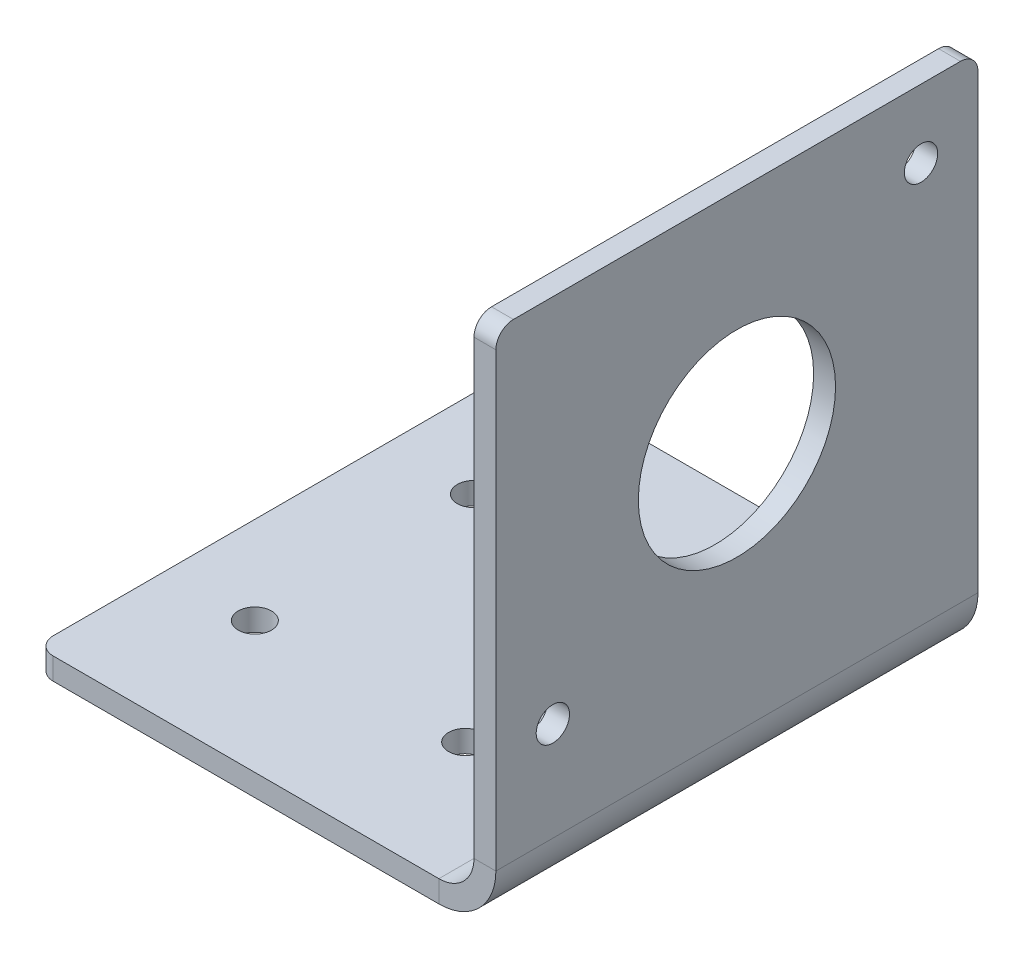
from build123d import *

# Parameters (mm, degrees)
SKETCH1_W              = 69.85
SKETCH1_H              = 76.2
SKETCH1_R              = 14.2875
SKETCH1_R_2            = 2.413
BOSS_EXTRUDE1_DEPTH    = 3.175
SKETCH2_W              = 69.85
SKETCH2_H              = 3.175
BOSS_EXTRUDE2_DEPTH    = 63.5
CONVERT_SOLID1_START   = -34.925
CONVERT_SOLID1_DEPTH   = 69.85
CONVERT_SOLID1_2_DEPTH = 69.85
FILLET1_R              = 2.54
SKETCH7_R              = 2.413
CUT_EXTRUDE1_DEPTH     = 103.881758587


# Read off the part's stored shape, not the designer's step: Convert-Solid1
with BuildPart() as part:
    # Sketch1 → Boss-Extrude1 (new body)
    with BuildSketch(Plane(origin=(0, 0, 0), x_dir=(0, 0, -1), z_dir=(1, 0, 0))):
        Rectangle(SKETCH1_W, SKETCH1_H)
        with Locations((0, 6.35)):
            Circle(SKETCH1_R, mode=Mode.SUBTRACT)
        with Locations((26.67, 28.194)):
            Circle(SKETCH1_R_2, mode=Mode.SUBTRACT)
        with Locations((-26.67, -15.494)):
            Circle(SKETCH1_R_2, mode=Mode.SUBTRACT)
    extrude(amount=BOSS_EXTRUDE1_DEPTH)

    # Sketch2 → Boss-Extrude2 (add)
    with BuildSketch(Plane.ZY):
        with Locations((0, -36.5125)):
            Rectangle(SKETCH2_W, SKETCH2_H)
    extrude(amount=BOSS_EXTRUDE2_DEPTH)

    # Convert-Solid1 outline → Convert-Solid1 (cut)
    with BuildSketch(Plane.XY.offset(CONVERT_SOLID1_START)):
        with BuildLine():
            Line((3.175, -38.1), (3.175, -29.845))
            ThreePointArc((3.175, -29.845), (0.757166479, -35.682166479), (-5.08, -38.1))
            Line((-5.08, -38.1), (3.175, -38.1))
        make_face()
    extrude(amount=CONVERT_SOLID1_DEPTH, mode=Mode.SUBTRACT)

    # Convert-Solid1 2 outline → Convert-Solid1 2 (add)
    with BuildSketch(Plane.XY.offset(CONVERT_SOLID1_START)):
        with BuildLine():
            Line((0, -34.925), (0, -29.845))
            ThreePointArc((0, -29.845), (-1.487897552, -33.437102448), (-5.08, -34.925))
            Line((-5.08, -34.925), (0, -34.925))
        make_face()
    extrude(amount=CONVERT_SOLID1_2_DEPTH)

    # Fillet1
    fillet1_edges = [part.edges().sort_by_distance(p)[0] for p in [
        (1.5875, 38.1, -34.925),
        (1.5875, 38.1, 34.925),
        (-63.5, -36.5125, 34.925),
        (-63.5, -36.5125, -34.925),
    ]]
    fillet(fillet1_edges, radius=FILLET1_R)

    # Sketch7 → Cut-Extrude1 (cut, through all)
    with BuildSketch(Plane(origin=(0, -34.925, 0), x_dir=(1, 0, 0), z_dir=(0, 1, 0))):
        with Locations(Location((-50.8, 15.875, 0), (0, 0, 270))):
            Circle(SKETCH7_R)
        with Locations(Location((-20.32, 15.875, 0), (0, 0, 270))):
            Circle(SKETCH7_R)
        with Locations(Location((-50.8, -15.875, 0), (0, 0, 270))):
            Circle(SKETCH7_R)
        with Locations(Location((-20.32, -15.875, 0), (0, 0, 270))):
            Circle(SKETCH7_R)
    extrude(amount=-CUT_EXTRUDE1_DEPTH, mode=Mode.SUBTRACT)


solid = part.part
